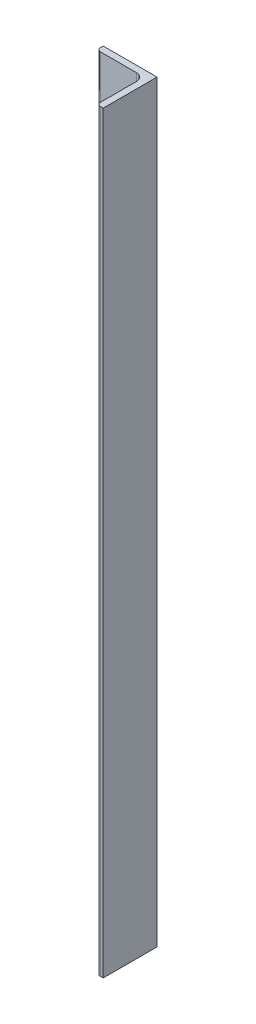
from build123d import *

# Parameters (mm, degrees)
BOSS_EXTRUDE1_DEPTH = 350
CUT_EXTRUDE1_REACH  = 359.071
SKETCH2_R           = 6


with BuildPart() as part:
    # Sketch1 → Boss-Extrude1 (new, symmetric)
    with BuildSketch(Plane(origin=(0, 0, 0), x_dir=(1, 0, 0), z_dir=(0, 1, 0))):
        with BuildLine():
            Line((0, 0), (-50, 0))
            Line((-50, 0), (-50, -2.5))
            ThreePointArc((-50, -2.5), (-48.974873734, -4.974873734), (-46.5, -6))
            Line((-46.5, -6), (-13, -6))
            ThreePointArc((-13, -6), (-8.050252532, -8.050252532), (-6, -13))
            Line((-6, -13), (-6, -46.5))
            ThreePointArc((-6, -46.5), (-4.974873734, -48.974873734), (-2.5, -50))
            Line((-2.5, -50), (0, -50))
            Line((0, -50), (0, 0))
        make_face()
    extrude(amount=BOSS_EXTRUDE1_DEPTH, both=True)

    # Sketch2 → Cut-Extrude1 (cut, up to next)
    with BuildSketch(Plane(origin=(0, 0, 0), x_dir=(-1, 0, 0), z_dir=(0, 0, -1)), mode=Mode.PRIVATE) as cut_extrude1_sk1:
        with Locations((30, 52.92)):
            Circle(SKETCH2_R)
    cut_extrude1_tool1 = extrude(cut_extrude1_sk1.sketch, amount=-CUT_EXTRUDE1_REACH, mode=Mode.PRIVATE) & part.part
    # Sketch2 → Cut-Extrude1 (cut, up to next)
    with BuildSketch(Plane(origin=(0, 0, 0), x_dir=(-1, 0, 0), z_dir=(0, 0, -1)), mode=Mode.PRIVATE) as cut_extrude1_sk2:
        with Locations((30, -52.92)):
            Circle(SKETCH2_R)
    cut_extrude1_tool2 = extrude(cut_extrude1_sk2.sketch, amount=-CUT_EXTRUDE1_REACH, mode=Mode.PRIVATE) & part.part
    add(cut_extrude1_tool1.solids().sort_by_distance((-30, 52.92, 0))[0], mode=Mode.SUBTRACT)
    add(cut_extrude1_tool2.solids().sort_by_distance((-30, -52.92, 0))[0], mode=Mode.SUBTRACT)


solid = part.part
